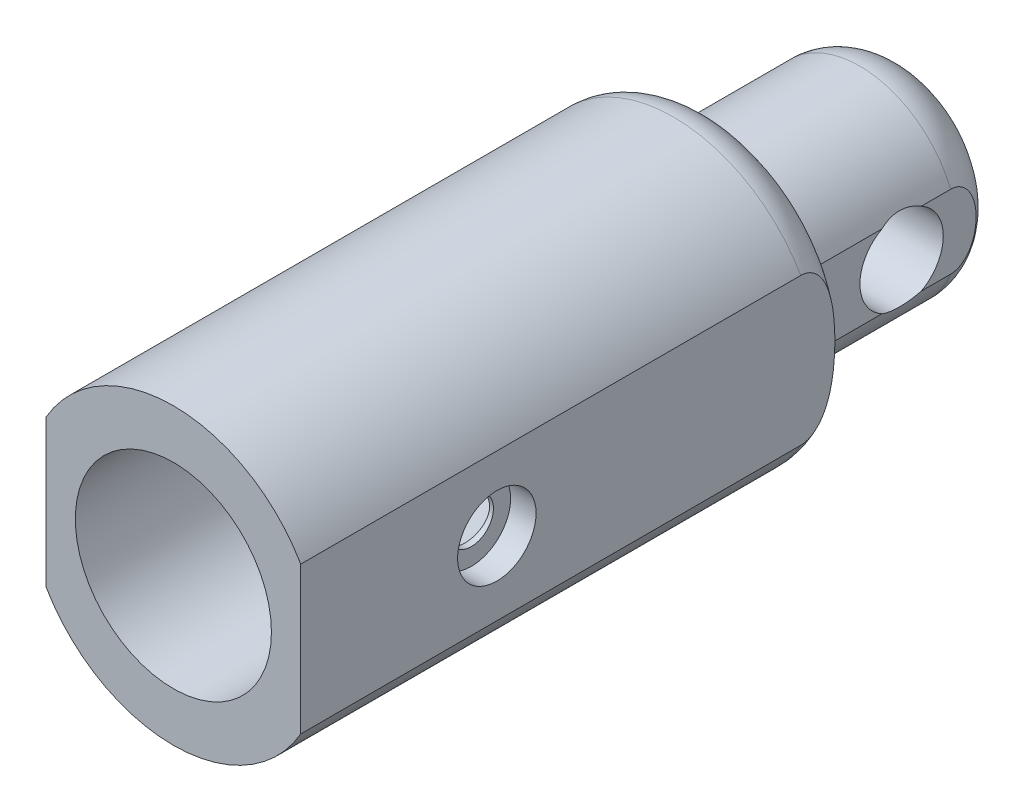
from build123d import *

# Parameters (mm, degrees)
BOSS_EXTRUDE2_DEPTH                         = 55
BOSS_EXTRUDE4_DEPTH                         = 20
CUT_EXTRUDE4_DEPTH                          = 78.580603246
CUT_EXTRUDE4_DEPTH_BACK                     = 78.580603246
SKETCH7_R                                   = 4.25
CUT_EXTRUDE5_REACH                          = 79.581
CUT_EXTRUDE5_END_RADIUS                     = 4.25
SKETCH8_R                                   = 2.25
CUT_EXTRUDE6_DEPTH                          = 4
SKETCH2_5_R                                 = 10
CUT_EXTRUDE7_DEPTH                          = 50
FILLET1_R                                   = 4
FILLET3_R                                   = 5
CBORE_FOR_M4_CHEESE_HEAD_SCREW1_D           = 4.5
CBORE_FOR_M4_CHEESE_HEAD_SCREW1_CBORE_D     = 8
CBORE_FOR_M4_CHEESE_HEAD_SCREW1_CBORE_DEPTH = 2.6
CUT_EXTRUDE8_DEPTH                          = 1


with BuildPart() as part:
    # Sketch2 → Boss-Extrude2 (new body)
    with BuildSketch(Plane.XY):
        with BuildLine():
            Line((12.990381057, -7.5), (12.990381057, 7.5))
            ThreePointArc((12.990381057, 7.5), (0, 15), (-12.990381057, 7.5))
            Line((-12.990381057, 7.5), (-12.990381057, -7.5))
            ThreePointArc((-12.990381057, -7.5), (0, -15), (12.990381057, -7.5))
        make_face()
    extrude(amount=-BOSS_EXTRUDE2_DEPTH)

    # Sketch6 → Boss-Extrude4 (add)
    with BuildSketch(Plane(origin=(0, 0, -55), x_dir=(-1, 0, 0), z_dir=(0, 0, -1))):
        with BuildLine():
            ThreePointArc((9.270248109, 3.75), (0, 10), (-9.270248109, 3.75))
            Line((-9.270248109, 3.75), (-9.270248109, -3.75))
            ThreePointArc((-9.270248109, -3.75), (0, -10), (9.270248109, -3.75))
            Line((9.270248109, -3.75), (9.270248109, 3.75))
        make_face()
    extrude(amount=BOSS_EXTRUDE4_DEPTH)

    # Sketch7 → Cut-Extrude4 (cut, two sides: drawn at the far end of the back side and taken through both)
    with BuildSketch(Plane(origin=(0, 0, 0), x_dir=(0, 0, -1), z_dir=(1, 0, 0)).offset(-CUT_EXTRUDE4_DEPTH_BACK)):
        with Locations(Location((65, 0, 0), (0, 0, 298.072486936))):
            Circle(SKETCH7_R)
    extrude(amount=CUT_EXTRUDE4_DEPTH + CUT_EXTRUDE4_DEPTH_BACK, mode=Mode.SUBTRACT)

    # Cut-Extrude5: up to this cylinder (the profile starts outside it)
    cut_extrude5_end = Plane(origin=(0, 0, -65), z_dir=(1, 0, 0)) * Cylinder(CUT_EXTRUDE5_END_RADIUS, 168.662, mode=Mode.PRIVATE)
    # Sketch8 → Cut-Extrude5 (cut, up to the surface)
    with BuildSketch(Plane(origin=(0, 0, -75), x_dir=(-1, 0, 0), z_dir=(0, 0, -1)), mode=Mode.PRIVATE) as cut_extrude5_sk1:
        Circle(SKETCH8_R)
    cut_extrude5_tool1 = extrude(cut_extrude5_sk1.sketch, amount=-CUT_EXTRUDE5_REACH, mode=Mode.PRIVATE) - cut_extrude5_end
    add(cut_extrude5_tool1.solids().sort_by_distance((0, 0, -75))[0], mode=Mode.SUBTRACT)

    # Sketch8<3> → Cut-Extrude6 (cut)
    with BuildSketch(Plane(origin=(0, 0, -75), x_dir=(-1, 0, 0), z_dir=(0, 0, -1))):
        Polygon((3.7, -2.136195996), (3.7, 2.136195996), (0, 4.272391992), (-3.7, 2.136195996), (-3.7, -2.136195996), (0, -4.272391992), align=None)
    extrude(amount=-CUT_EXTRUDE6_DEPTH, mode=Mode.SUBTRACT)

    # Sketch2<5> → Cut-Extrude7 (cut)
    with BuildSketch(Plane.XY):
        Circle(SKETCH2_5_R)
    extrude(amount=-CUT_EXTRUDE7_DEPTH, mode=Mode.SUBTRACT)

    # Fillet1
    # the kernel refuses this fillet: 4 mm, written as the material it takes off along each edge
    with BuildSketch(Plane(origin=(0, 0, -55), x_dir=(-0.9897152245182474, 0.1430516492627579, 0), z_dir=(0.1430516492627579, 0.9897152245182474, 0))) as fillet1_piece_1:
        with BuildLine():
            CenterArc((15 - FILLET1_R, FILLET1_R), FILLET1_R, 270, 90)
            Line((15 - FILLET1_R, 0), (15, 0))
            Line((15, 0), (15, FILLET1_R))
        make_face()
    revolve(axis=Axis((0, 0, -55), (0, 0, 1)), revolution_arc=196.448941493, mode=Mode.SUBTRACT)
    with BuildSketch(Plane(origin=(0, 0, -55), x_dir=(0.9897152245182473, -0.14305164926275812, 0), z_dir=(-0.14305164926275812, -0.9897152245182473, 0))) as fillet1_piece_2:
        with BuildLine():
            CenterArc((15 - FILLET1_R, FILLET1_R), FILLET1_R, 270, 90)
            Line((15 - FILLET1_R, 0), (15, 0))
            Line((15, 0), (15, FILLET1_R))
        make_face()
    revolve(axis=Axis((0, 0, -55), (0, 0, 1)), revolution_arc=196.448941493, mode=Mode.SUBTRACT)

    # Fillet3
    # the kernel refuses this fillet: 5 mm, written as the material it takes off along each edge
    with BuildSketch(Plane(origin=(0, 0, -75), x_dir=(-0.647307646342804, -0.7622288442365189, 0), z_dir=(0.7622288442365189, -0.647307646342804, 0))) as fillet3_piece_1:
        with BuildLine():
            CenterArc((10 - FILLET3_R, -FILLET3_R), FILLET3_R, 0, 90)
            Line((10, -FILLET3_R), (10, 0))
            Line((10, 0), (10 - FILLET3_R, 0))
        make_face()
    revolve(axis=Axis((0, 0, -75), (0, 0, -1)), revolution_arc=279.32216765, mode=Mode.SUBTRACT)
    with BuildSketch(Plane(origin=(0, 0, -75), x_dir=(0.6473076463428042, 0.7622288442365188, 0), z_dir=(-0.7622288442365188, 0.6473076463428042, 0))) as fillet3_piece_2:
        with BuildLine():
            CenterArc((10 - FILLET3_R, -FILLET3_R), FILLET3_R, 0, 90)
            Line((10, -FILLET3_R), (10, 0))
            Line((10, 0), (10 - FILLET3_R, 0))
        make_face()
    revolve(axis=Axis((0, 0, -75), (0, 0, -1)), revolution_arc=279.32216765, mode=Mode.SUBTRACT)

    # CBORE for M4 Cheese Head Screw1 (through all)
    with Locations(Plane(origin=(12.990381057, 0, 0), x_dir=(0, 0, -1), z_dir=(1, 0, 0))):
        with Locations((20, 0)):
            CounterBoreHole(CBORE_FOR_M4_CHEESE_HEAD_SCREW1_D / 2, CBORE_FOR_M4_CHEESE_HEAD_SCREW1_CBORE_D / 2, CBORE_FOR_M4_CHEESE_HEAD_SCREW1_CBORE_DEPTH)

    # Sketch9 → Cut-Extrude8 (cut)
    with BuildSketch(Plane.ZY.offset(12.990381057)):
        Polygon((-15.669872981, 0), (-17.834936491, 3.75), (-22.165063509, 3.75), (-24.330127019, 0), (-22.165063509, -3.75), (-17.834936491, -3.75), align=None)
    extrude(amount=-CUT_EXTRUDE8_DEPTH, mode=Mode.SUBTRACT)


solid = part.part
